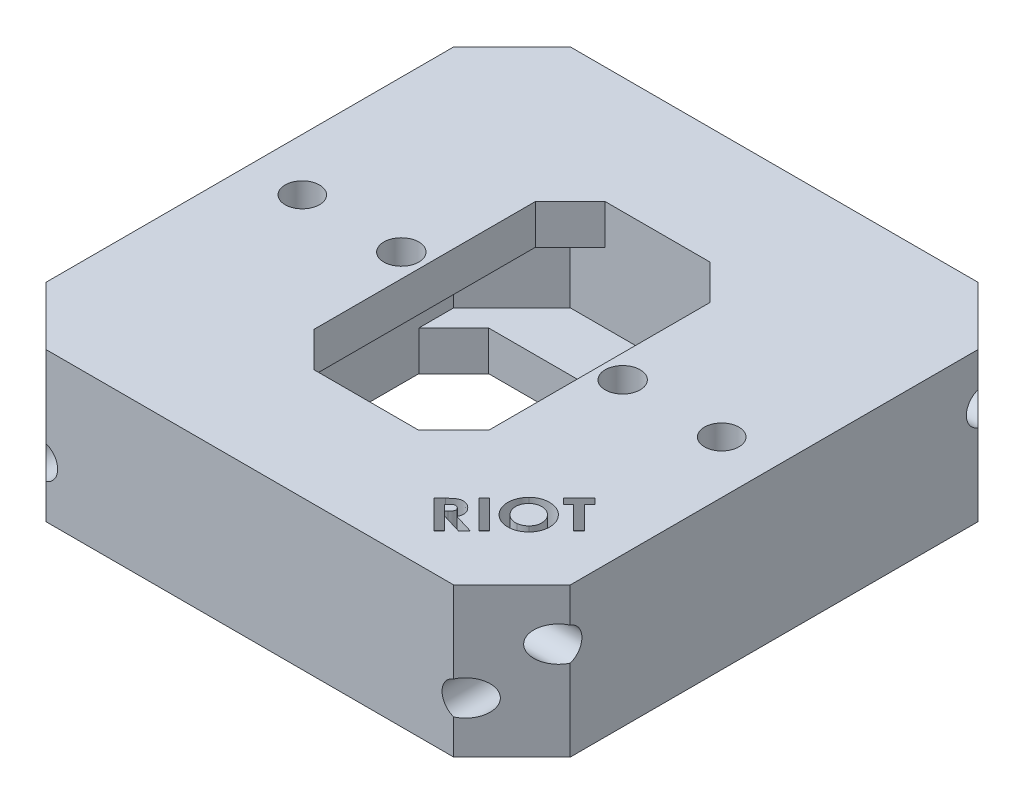
from build123d import *
from build123d.topology import SkipClean

# Parameters (mm, degrees)
SKETCH_1_W              = 45
SKETCH_1_H              = 10
SKETCH_1_R              = 1.5
EXTRUDE_1_DEPTH         = 45
SKETCH_2_R              = 1.5
CUT_EXTRUDE_1_DEPTH     = 45
CHAMFER_1_SIZE          = 5
SKETCH_4_W              = 25
SKETCH_4_H              = 25
CUT_EXTRUDE_3_DEPTH     = 52.295711322
CHAMFER_2_SIZE          = 5
SKETCH_5_R              = 1.5
EXTRUDE_2_DEPTH         = 2
EXTRUDE_3_DEPTH         = 2
CHAMFER_3_SIZE          = 3
CUT_EXTRUDE_4_DEPTH     = 1
CUT_EXTRUDE_START       = -10
CUT_EXTRUDE_5_OUTLINE_R = 1.5
CUT_EXTRUDE_5_DEPTH     = 7
SKETCH_16_R             = 1.475
CUT_EXTRUDE_6_DEPTH     = 7
EXTRUDE_START           = 1.4
SKETCH_16_3_R           = 1.5
SKETCH_16_3_R_2         = 1.475
EXTRUDE_4_DEPTH         = 1.4
SKETCH_17_R             = 2.75
SKETCH_17_R_2           = 1.5
EXTRUDE_5_DEPTH         = 1.4
EXTRUDE_6_DEPTH         = 1.4


# Read off the part's stored shape, not the designer's step: 컷-돌출5
with BuildPart() as part:
    # 스케치1 → 보스-돌출1 (new body)
    with BuildSketch(Plane(origin=(0, 0, 0), x_dir=(0, 0, -1), z_dir=(1, 0, 0))):
        Rectangle(SKETCH_1_W, SKETCH_1_H)
        with Locations(Location((-18, 2, 0), (0, 0, 180))):
            Circle(SKETCH_1_R, mode=Mode.SUBTRACT)
        with Locations(Location((18, 2, 0), (0, 0, 180))):
            Circle(SKETCH_1_R, mode=Mode.SUBTRACT)
    extrude(amount=EXTRUDE_1_DEPTH)

    # 스케치2 → 컷-돌출1 (cut)
    with BuildSketch(Plane.XY.offset(22.5)):
        with Locations((4.5, -2)):
            Circle(SKETCH_2_R)
        with Locations((40.5, -2)):
            Circle(SKETCH_2_R)
    extrude(amount=-CUT_EXTRUDE_1_DEPTH, mode=Mode.SUBTRACT)

    # 모따기1
    # the kernel refuses this chamfer: 5 mm, written as the material it takes off along each edge
    with BuildSketch(Plane(origin=(45, 17.85841494, 22.5), x_dir=(-0.9996219169112968, 0, 0.027495876610586317), z_dir=(0, -1, 0)), Plane(origin=(45, -17.85841494, -22.5), x_dir=(-0.9996219169112968, 0, -0.027495876610586317), z_dir=(0, 1, 0))) as chamfer_1_piece_1:
        Polygon((CHAMFER_1_SIZE * 0.999621916911, CHAMFER_1_SIZE * 0.0274958766106), (-CHAMFER_1_SIZE * 0.0274958766106, CHAMFER_1_SIZE * 0.999621916911), (0, 0), align=None)
    extrude(amount=35.71682988, mode=Mode.SUBTRACT)
    with BuildSketch(Plane(origin=(0, 17.85841494, 22.5), x_dir=(0.9996219169112968, 0, 0.027495876610586317), z_dir=(0, -1, 0)), Plane(origin=(0, -17.85841494, -22.5), x_dir=(0.9996219169112968, 0, -0.027495876610586317), z_dir=(0, 1, 0))) as chamfer_1_piece_2:
        Polygon((CHAMFER_1_SIZE * 0.999621916911, -CHAMFER_1_SIZE * 0.0274958766106), (-CHAMFER_1_SIZE * 0.0274958766106, -CHAMFER_1_SIZE * 0.999621916911), (0, 0), align=None)
    extrude(amount=35.71682988, mode=Mode.SUBTRACT)

    # 스케치4 → 컷-돌출3 (cut, through all)
    with BuildSketch(Plane.XZ.offset(5)):
        with Locations((22.5, 0)):
            Rectangle(SKETCH_4_W, SKETCH_4_H)
    extrude(amount=-CUT_EXTRUDE_3_DEPTH, mode=Mode.SUBTRACT)

    # 모따기2
    chamfer_2_edges = [part.edges().sort_by_distance(p)[0] for p in [
        (35, 0, 12.5),
        (35, 0, -12.5),
        (10, 0, -12.5),
        (10, 0, 12.5),
    ]]
    chamfer(chamfer_2_edges, length=CHAMFER_2_SIZE)

    # 스케치5 → 보스-돌출2 (add)
    # profile 1 of 2: a face of its own
    with BuildSketch(Plane(origin=(0, 5, 0), x_dir=(1, 0, 0), z_dir=(0, 1, 0))):
        Polygon((15, 12.5), (10, 7.5), (10, -7.5), (15, -12.5), align=None)
        with Locations(Location((13, 0, 0), (0, 0, 270))):
            Circle(SKETCH_5_R, mode=Mode.SUBTRACT)
    # profile 2 of 2: a face of its own
    with BuildSketch(Plane(origin=(0, 5, 0), x_dir=(1, 0, 0), z_dir=(0, 1, 0))):
        Polygon((35, 7.5), (30, 12.5), (30, -12.5), (35, -7.5), align=None)
        with Locations(Location((32, 0, 0), (0, 0, 270))):
            Circle(SKETCH_5_R, mode=Mode.SUBTRACT)
    extrude(amount=-EXTRUDE_2_DEPTH)

    # 스케치14 → 보스-돌출3 (add)
    with BuildSketch(Plane.XZ.offset(5)):
        with BuildLine():
            Line((22.5, 12.5), (15, 12.5))
            Line((15, 12.5), (10, 7.5))
            Line((10, 7.5), (22.5, 7.5))
            Line((22.5, 7.5), (22.5, 8))
            ThreePointArc((22.5, 8), (21, 9.5), (22.5, 11))
            Line((22.5, 11), (22.5, 12.5))
        make_face()
        with BuildLine():
            Line((30, 12.5), (22.5, 12.5))
            Line((22.5, 12.5), (22.5, 11))
            ThreePointArc((22.5, 11), (23.560660172, 10.560660172), (24, 9.5))
            ThreePointArc((24, 9.5), (23.560660172, 8.439339828), (22.5, 8))
            Line((22.5, 8), (22.5, 7.5))
            Line((22.5, 7.5), (35, 7.5))
            Line((35, 7.5), (30, 12.5))
        make_face()
        with BuildLine():
            Line((22.5, -7.5), (10, -7.5))
            Line((10, -7.5), (15, -12.5))
            Line((15, -12.5), (22.5, -12.5))
            Line((22.5, -12.5), (22.5, -11))
            ThreePointArc((22.5, -11), (21, -9.5), (22.5, -8))
            Line((22.5, -8), (22.5, -7.5))
        make_face()
        with BuildLine():
            Line((35, -7.5), (22.5, -7.5))
            Line((22.5, -7.5), (22.5, -8))
            ThreePointArc((22.5, -8), (23.560660172, -8.439339828), (24, -9.5))
            ThreePointArc((24, -9.5), (23.560660172, -10.560660172), (22.5, -11))
            Line((22.5, -11), (22.5, -12.5))
            Line((22.5, -12.5), (30, -12.5))
            Line((30, -12.5), (35, -7.5))
        make_face()
    extrude(amount=-EXTRUDE_3_DEPTH)

    # 모따기3
    chamfer_3_edges = [part.edges().sort_by_distance(p)[0] for p in [
        (10, -4, -7.5),
        (30, 4, 12.5),
        (15, 4, 12.5),
        (30, 4, -12.5),
        (10, -4, 7.5),
        (35, -4, -7.5),
        (35, -4, 7.5),
        (15, 4, -12.5),
    ]]
    chamfer(chamfer_3_edges, length=CHAMFER_3_SIZE)

    # 스케치7 → 컷-돌출4 (cut)
    # profile 1 of 4: a face of its own
    with BuildSketch(Plane(origin=(0, 5, 0), x_dir=(1, 0, 0), z_dir=(0, 1, 0))):
        with BuildLine():
            Line((32.69686165, -16.903699247), (33.191853637, -16.40870726))
            add(Edge.make_bspline(
                [(33.191853637, -16.40870726), (33.224607432, -16.376248536), (33.287670671, -16.313753417), (33.381930551, -16.226834822), (33.470630659, -16.148758016), (33.554657915, -16.080760449), (33.633419233, -16.02217285), (33.706831072, -15.972764042), (33.775533398, -15.93297044), (33.860329626, -15.893900224), (33.965605336, -15.859904661), (34.09508357, -15.839947634), (34.228088263, -15.84176179), (34.339500518, -15.860481767), (34.428871525, -15.883838888), (34.495162982, -15.908322558), (34.560225862, -15.936736442), (34.623931754, -15.970816372), (34.686085271, -16.010161334), (34.747366662, -16.05417477), (34.806330336, -16.104480821), (34.844108699, -16.140687951), (34.863327996, -16.159107901)],
                knots=[0, 0, 0, 0, 1.422154072, 2.738175696, 3.954007428, 5.066258713, 6.07111109, 6.980756347, 7.794367798, 8.516816989, 9.857210367, 11.19167909, 12.539706685, 13.941622086, 14.665508274, 15.386049031, 16.118675321, 16.85392105, 17.611889264, 18.386168488, 19.178982248, 20, 20, 20, 20], degree=3))
            add(Edge.make_bspline(
                [(34.863327996, -16.159107901), (34.882817903, -16.179149167), (34.921073132, -16.218486614), (34.971877821, -16.281393644), (35.018150795, -16.344139417), (35.056692325, -16.409268121), (35.089555533, -16.47516444), (35.117630745, -16.541840879), (35.137442806, -16.610216106), (35.152709568, -16.679248782), (35.1607445, -16.749476952), (35.163817599, -16.820973714), (35.160194113, -16.893705718), (35.150197519, -16.967771734), (35.134130783, -17.042826498), (35.110994783, -17.118908015), (35.083559092, -17.196760523), (35.060273514, -17.247878885), (35.04842415, -17.273891555)],
                knots=[0, 0, 0, 0, 1.101689547, 2.162421059, 3.185457246, 4.17318816, 5.14164527, 6.087972672, 7.020925025, 7.944500735, 8.872616505, 9.804065822, 10.763537599, 11.739680304, 12.748212312, 13.786204576, 14.873462919, 16, 16, 16, 16], degree=3))
            Line((35.04842415, -17.273891555), (36.717094022, -17.782905978))
            Line((36.717094022, -17.782905978), (36.207378477, -18.292621523))
            Line((36.207378477, -18.292621523), (34.61863649, -17.806042997))
            Line((34.61863649, -17.806042997), (34.575166939, -17.849512549))
            Line((34.575166939, -17.849512549), (35.612827195, -18.887172805))
            Line((35.612827195, -18.887172805), (35.146581201, -19.353418799))
            Line((35.146581201, -19.353418799), (32.69686165, -16.903699247))
        make_face()
        with BuildLine():
            Line((34.120840015, -17.395185626), (34.267374471, -17.24865117))
            add(Edge.make_bspline(
                [(34.267374471, -17.24865117), (34.285061302, -17.230570544), (34.318955448, -17.19592175), (34.365192156, -17.143729348), (34.406263823, -17.094864234), (34.440863472, -17.047884552), (34.468700195, -17.003205247), (34.49122115, -16.961550022), (34.506721484, -16.921937517), (34.520212458, -16.87313539), (34.522257608, -16.811772684), (34.504794782, -16.739163289), (34.464768514, -16.668893029), (34.426985206, -16.627649571), (34.406897708, -16.605722485)],
                knots=[0, 0, 0, 0, 1.200968113, 2.30147435, 3.310417574, 4.231675387, 5.069313759, 5.80902267, 6.476791062, 7.085197515, 8.207043583, 9.348428935, 10.590292078, 12, 12, 12, 12], degree=3))
            add(Edge.make_bspline(
                [(34.406897708, -16.605722485), (34.393402946, -16.593450494), (34.367046194, -16.56948195), (34.323258746, -16.540119649), (34.276182529, -16.51957649), (34.227143333, -16.507059955), (34.177249915, -16.502066364), (34.12732162, -16.504910809), (34.077975223, -16.515686783), (34.036977506, -16.530797721), (34.003556989, -16.548879317), (33.974827526, -16.56607619), (33.94415958, -16.589005092), (33.910467171, -16.615896569), (33.873158956, -16.646307605), (33.834208239, -16.682734586), (33.791360202, -16.722126471), (33.762697264, -16.750746465), (33.747843221, -16.765578254)],
                knots=[0, 0, 0, 0, 1.128469128, 2.204024108, 3.24716467, 4.293011438, 5.325357643, 6.339905205, 7.375794654, 8.442749747, 9.03176661, 9.726624713, 10.513874098, 11.399736492, 12.396482678, 13.492478502, 14.700522811, 16, 16, 16, 16], degree=3))
            Line((33.747843221, -16.765578254), (33.619537932, -16.893883542))
            Line((33.619537932, -16.893883542), (34.120840015, -17.395185626))
        make_face(mode=Mode.SUBTRACT)
    # profile 2 of 4: a face of its own
    with BuildSketch(Plane(origin=(0, 5, 0), x_dir=(1, 0, 0), z_dir=(0, 1, 0))):
        Polygon((34.631294923, -14.969265975), (35.094035307, -14.50652559), (37.543754858, -16.956245142), (37.081014474, -17.418985526), align=None)
    # profile 3 of 4: a face of its own
    with BuildSketch(Plane(origin=(0, 5, 0), x_dir=(1, 0, 0), z_dir=(0, 1, 0))):
        with BuildLine():
            add(Edge.make_bspline(
                [(36.711975525, -12.765187936), (36.755532817, -12.723542034), (36.841491891, -12.641355033), (36.983778236, -12.536369686), (37.132223388, -12.446631233), (37.288052443, -12.372996122), (37.451599228, -12.317022117), (37.622109966, -12.276920325), (37.79963219, -12.253272127), (37.981965934, -12.245713484), (38.164605465, -12.25448407), (38.343307689, -12.280504441), (38.515568224, -12.323186499), (38.681239301, -12.383064424), (38.839991055, -12.460081199), (38.991938886, -12.554076656), (39.138176398, -12.664241719), (39.227696417, -12.749314103), (39.273173442, -12.792531686)],
                knots=[0, 0, 0, 0, 1.014654119, 2.002390975, 2.972293047, 3.934222426, 4.900712244, 5.879869384, 6.881321836, 7.914074224, 8.951120508, 9.958117793, 10.95246705, 11.9366565, 12.921287122, 13.92029724, 14.943491126, 16, 16, 16, 16], degree=3))
            add(Edge.make_bspline(
                [(39.273173442, -12.792531686), (39.315883883, -12.837574141), (39.400044698, -12.926330183), (39.509539062, -13.07093332), (39.602823109, -13.221505088), (39.678999866, -13.37868177), (39.738183457, -13.542218987), (39.780526235, -13.712323254), (39.805297794, -13.888776996), (39.814470606, -14.069239359), (39.806776634, -14.24925402), (39.783239133, -14.424975102), (39.742443688, -14.594186284), (39.684613599, -14.756658429), (39.610822654, -14.91270353), (39.519267663, -15.061038485), (39.412747664, -15.204026587), (39.329964783, -15.291201005), (39.287897, -15.335500436)],
                knots=[0, 0, 0, 0, 1.051548114, 2.072072851, 3.068153082, 4.049734895, 5.027207055, 6.011088518, 7.015617405, 8.042955091, 9.069926077, 10.065509878, 11.043656146, 12.014725186, 12.984022916, 13.963756318, 14.96524187, 16, 16, 16, 16], degree=3))
            add(Edge.make_bspline(
                [(39.287897, -15.335500436), (39.241760237, -15.379470424), (39.151264361, -15.465716237), (39.002974685, -15.576852413), (38.849875723, -15.6714323), (38.689521803, -15.746973256), (38.523812357, -15.805639308), (38.351399212, -15.84558232), (38.173087409, -15.868006687), (37.990888181, -15.872471118), (37.809242972, -15.860809153), (37.632200511, -15.832803767), (37.462205679, -15.788596597), (37.298928096, -15.728634248), (37.142937253, -15.652766266), (36.994095663, -15.560609182), (36.85142195, -15.453494759), (36.764464781, -15.370537557), (36.720388987, -15.328489218)],
                knots=[0, 0, 0, 0, 1.068725463, 2.096272975, 3.103195773, 4.083868974, 5.065012596, 6.047722666, 7.047870852, 8.075777557, 9.101564702, 10.09838547, 11.079121407, 12.044468732, 13.012695726, 13.984672525, 14.978495282, 16, 16, 16, 16], degree=3))
            add(Edge.make_bspline(
                [(36.720388987, -15.328489218), (36.691945083, -15.298935997), (36.635520731, -15.240311087), (36.558485324, -15.146626434), (36.488122967, -15.049766129), (36.424862209, -14.949289741), (36.368714667, -14.845274442), (36.319277996, -14.737945567), (36.278268103, -14.626587359), (36.242948721, -14.512757558), (36.215878773, -14.396730565), (36.196194186, -14.280127799), (36.183864724, -14.16327175), (36.180965357, -14.046373882), (36.183847734, -13.929227021), (36.196461634, -13.812237533), (36.21482678, -13.694734981), (36.242743545, -13.578106253), (36.276203817, -13.462741145), (36.319020083, -13.351537301), (36.36629191, -13.243273443), (36.422086116, -13.139886697), (36.483743453, -13.039450726), (36.553537938, -12.944126799), (36.628236671, -12.851065146), (36.683912745, -12.793967327), (36.711975525, -12.765187936)],
                knots=[0, 0, 0, 0, 1.035920658, 2.054962298, 3.061180531, 4.058787372, 5.052104391, 6.045509142, 7.041297254, 8.047948452, 9.054738158, 10.048686678, 11.03391657, 12.020366407, 13.000914665, 13.992018259, 14.990829929, 16.003368278, 17.019618089, 18.023008813, 19.011559078, 20.002082148, 20.988425963, 21.986399645, 22.9850717, 24, 24, 24, 24], degree=3))
        make_face()
        with BuildLine():
            add(Edge.make_bspline(
                [(37.163497961, -13.226526077), (37.136219872, -13.254957919), (37.08257697, -13.310869698), (37.014169414, -13.402928052), (36.954866624, -13.497880203), (36.908151077, -13.597935393), (36.871459032, -13.701465673), (36.84503826, -13.808981945), (36.830820246, -13.920674302), (36.826469993, -14.034978144), (36.833409424, -14.149605568), (36.85171309, -14.262352336), (36.881037304, -14.371937364), (36.922270332, -14.478008412), (36.97448449, -14.580826236), (37.037913559, -14.680538204), (37.112329539, -14.777242678), (37.169460514, -14.836814537), (37.198554051, -14.867151077)],
                knots=[0, 0, 0, 0, 1.029769062, 2.025061205, 2.993902875, 3.953811187, 4.907077266, 5.863474848, 6.84397402, 7.84727022, 8.851757806, 9.842759715, 10.830437119, 11.813639021, 12.814324118, 13.842131367, 14.90112093, 16, 16, 16, 16], degree=3))
            add(Edge.make_bspline(
                [(37.198554051, -14.867151077), (37.232273535, -14.899203514), (37.298337923, -14.962001763), (37.406500914, -15.04207695), (37.518123941, -15.108587768), (37.633867866, -15.16027969), (37.753303556, -15.196955094), (37.876328769, -15.219348672), (38.003447269, -15.228535924), (38.088995407, -15.222287838), (38.132448282, -15.219114218)],
                knots=[0, 0, 0, 0, 1.079353868, 2.114707675, 3.116998339, 4.091101001, 5.050584441, 6.010604784, 6.989516965, 8, 8, 8, 8], degree=3))
            add(Edge.make_bspline(
                [(38.132448282, -15.219114218), (38.166182752, -15.214706154), (38.23293114, -15.20598418), (38.330675649, -15.184308529), (38.424583065, -15.154038814), (38.514344389, -15.115056833), (38.601056208, -15.069457553), (38.68412883, -15.016089895), (38.763033166, -14.954097308), (38.811739404, -14.90753087), (38.836374564, -14.883978)],
                knots=[0, 0, 0, 0, 1.025969275, 2.030024327, 3.015491562, 3.997700127, 4.978516044, 5.968060363, 6.972263918, 8, 8, 8, 8], degree=3))
            add(Edge.make_bspline(
                [(38.836374564, -14.883978), (38.862987701, -14.8562727), (38.915436155, -14.80167184), (38.981650092, -14.710739899), (39.039290191, -14.61695475), (39.084829188, -14.517641448), (39.121059569, -14.414515743), (39.14537135, -14.306492007), (39.159391471, -14.19449279), (39.162703878, -14.079473128), (39.15580548, -13.964016826), (39.138624616, -13.850693036), (39.109425096, -13.741350166), (39.070156873, -13.635841894), (39.020000696, -13.534042919), (38.958600982, -13.436601971), (38.886875672, -13.342370429), (38.831589387, -13.284669728), (38.80342184, -13.255272071)],
                knots=[0, 0, 0, 0, 1.015027565, 2.000389023, 2.968300073, 3.922453554, 4.884285459, 5.854503292, 6.845124793, 7.865559069, 8.893567005, 9.900733638, 10.891837198, 11.881590401, 12.874061732, 13.887733113, 14.923831134, 16, 16, 16, 16], degree=3))
            add(Edge.make_bspline(
                [(38.80342184, -13.255272071), (38.773976402, -13.227398123), (38.716071372, -13.172583458), (38.622361792, -13.100595517), (38.524228606, -13.040376526), (38.4228899, -12.988943526), (38.316715544, -12.949770223), (38.206407624, -12.921917414), (38.092662432, -12.903278291), (37.976161732, -12.896755251), (37.860255784, -12.900031495), (37.746939702, -12.913783726), (37.638404303, -12.939477352), (37.533477278, -12.97390891), (37.434387068, -13.022185447), (37.338417133, -13.078601933), (37.247432155, -13.147134737), (37.191756422, -13.199797077), (37.163497961, -13.226526077)],
                knots=[0, 0, 0, 0, 1.065222127, 2.094780232, 3.098807823, 4.08774636, 5.077009148, 6.066252866, 7.074087619, 8.10173825, 9.128011098, 10.118474599, 11.095919373, 12.055501853, 13.014415649, 13.986751589, 14.978167001, 16, 16, 16, 16], degree=3))
        make_face(mode=Mode.SUBTRACT)
    # profile 4 of 4: a face of its own
    with BuildSketch(Plane(origin=(0, 5, 0), x_dir=(1, 0, 0), z_dir=(0, 1, 0))):
        Polygon((38.262288952, -11.338271945), (39.616155138, -9.984405759), (40.076091036, -10.444341657), (39.629476452, -10.89095624), (41.619260106, -12.880739894), (41.146704017, -13.353295983), (39.156920363, -11.36351233), (38.72222485, -11.798207842), align=None)
    extrude(amount=-CUT_EXTRUDE_4_DEPTH, mode=Mode.SUBTRACT)

    # 컷-돌출5 outline → 컷-돌출5 (cut)
    with BuildSketch(Plane(origin=(0, 5, 0), x_dir=(1, 0, 0), z_dir=(0, 1, 0)).offset(CUT_EXTRUDE_START)):
        with Locations((22.5, -17.5)):
            Circle(CUT_EXTRUDE_5_OUTLINE_R)
        with Locations((22.5, 17.5)):
            Circle(CUT_EXTRUDE_5_OUTLINE_R)
    extrude(amount=CUT_EXTRUDE_5_DEPTH, mode=Mode.SUBTRACT)

    # 스케치16 → 컷-돌출6 (cut)
    with BuildSketch(Plane(origin=(0, 5, 0), x_dir=(1, 0, 0), z_dir=(0, 1, 0))):
        with Locations(Location((4.5, 0, 0), (0, 0, 270))):
            Circle(SKETCH_16_R)
        with Locations(Location((40.5, 0, 0), (0, 0, 270))):
            Circle(SKETCH_16_R)
    extrude(amount=-CUT_EXTRUDE_6_DEPTH, mode=Mode.SUBTRACT)

    # 스케치16<3> → 보스-돌출4 (add)
    with BuildSketch(Plane(origin=(0, 5, 0), x_dir=(1, 0, 0), z_dir=(0, 1, 0)).offset(EXTRUDE_START)):
        Polygon((5, 22.5), (0, 17.5), (0, -17.5), (5, -22.5), (40, -22.5), (45, -17.5), (45, 17.5), (40, 22.5), align=None)
        with BuildLine():
            Line((35.146581201, -19.353418799), (32.69686165, -16.903699247))
            Line((32.69686165, -16.903699247), (33.191853637, -16.40870726))
            add(Edge.make_bspline(
                [(33.191853637, -16.40870726), (33.224607432, -16.376248536), (33.287670671, -16.313753417), (33.381930551, -16.226834822), (33.470630659, -16.148758016), (33.554657915, -16.080760449), (33.633419233, -16.02217285), (33.706831072, -15.972764042), (33.775533398, -15.93297044), (33.860329626, -15.893900224), (33.965605336, -15.859904661), (34.09508357, -15.839947634), (34.228088263, -15.84176179), (34.339500518, -15.860481767), (34.428871525, -15.883838888), (34.495162982, -15.908322558), (34.560225862, -15.936736442), (34.623931754, -15.970816372), (34.686085271, -16.010161334), (34.747366662, -16.05417477), (34.806330336, -16.104480821), (34.844108699, -16.140687951), (34.863327996, -16.159107901)],
                knots=[0, 0, 0, 0, 1.422154072, 2.738175696, 3.954007428, 5.066258713, 6.07111109, 6.980756347, 7.794367798, 8.516816989, 9.857210367, 11.19167909, 12.539706685, 13.941622086, 14.665508274, 15.386049031, 16.118675321, 16.85392105, 17.611889264, 18.386168488, 19.178982248, 20, 20, 20, 20], degree=3))
            add(Edge.make_bspline(
                [(34.863327996, -16.159107901), (34.882817903, -16.179149167), (34.921073132, -16.218486614), (34.971877821, -16.281393644), (35.018150795, -16.344139417), (35.056692325, -16.409268121), (35.089555533, -16.47516444), (35.117630745, -16.541840879), (35.137442806, -16.610216106), (35.152709568, -16.679248782), (35.1607445, -16.749476952), (35.163817599, -16.820973714), (35.160194113, -16.893705718), (35.150197519, -16.967771734), (35.134130783, -17.042826498), (35.110994783, -17.118908015), (35.083559092, -17.196760523), (35.060273514, -17.247878885), (35.04842415, -17.273891555)],
                knots=[0, 0, 0, 0, 1.101689547, 2.162421059, 3.185457246, 4.17318816, 5.14164527, 6.087972672, 7.020925025, 7.944500735, 8.872616505, 9.804065822, 10.763537599, 11.739680304, 12.748212312, 13.786204576, 14.873462919, 16, 16, 16, 16], degree=3))
            Line((35.04842415, -17.273891555), (36.717094022, -17.782905978))
            Line((36.717094022, -17.782905978), (36.207378477, -18.292621523))
            Line((36.207378477, -18.292621523), (34.61863649, -17.806042997))
            Line((34.61863649, -17.806042997), (34.575166939, -17.849512549))
            Line((34.575166939, -17.849512549), (35.612827195, -18.887172805))
            Line((35.612827195, -18.887172805), (35.146581201, -19.353418799))
        make_face(mode=Mode.SUBTRACT)
        Polygon((37.081014474, -17.418985526), (34.631294923, -14.969265975), (35.094035307, -14.50652559), (37.543754858, -16.956245142), align=None, mode=Mode.SUBTRACT)
        with BuildLine():
            add(Edge.make_bspline(
                [(36.720388987, -15.328489218), (36.691945083, -15.298935997), (36.635520731, -15.240311087), (36.558485324, -15.146626434), (36.488122967, -15.049766129), (36.424862209, -14.949289741), (36.368714667, -14.845274442), (36.319277996, -14.737945567), (36.278268103, -14.626587359), (36.242948721, -14.512757558), (36.215878773, -14.396730565), (36.196194186, -14.280127799), (36.183864724, -14.16327175), (36.180965357, -14.046373882), (36.183847734, -13.929227021), (36.196461634, -13.812237533), (36.21482678, -13.694734981), (36.242743545, -13.578106253), (36.276203817, -13.462741145), (36.319020083, -13.351537301), (36.36629191, -13.243273443), (36.422086116, -13.139886697), (36.483743453, -13.039450726), (36.553537938, -12.944126799), (36.628236671, -12.851065146), (36.683912745, -12.793967327), (36.711975525, -12.765187936)],
                knots=[0, 0, 0, 0, 1.035920658, 2.054962298, 3.061180531, 4.058787372, 5.052104391, 6.045509142, 7.041297254, 8.047948452, 9.054738158, 10.048686678, 11.03391657, 12.020366407, 13.000914665, 13.992018259, 14.990829929, 16.003368278, 17.019618089, 18.023008813, 19.011559078, 20.002082148, 20.988425963, 21.986399645, 22.9850717, 24, 24, 24, 24], degree=3))
            add(Edge.make_bspline(
                [(36.711975525, -12.765187936), (36.755532817, -12.723542034), (36.841491891, -12.641355033), (36.983778236, -12.536369686), (37.132223388, -12.446631233), (37.288052443, -12.372996122), (37.451599228, -12.317022117), (37.622109966, -12.276920325), (37.79963219, -12.253272127), (37.981965934, -12.245713484), (38.164605465, -12.25448407), (38.343307689, -12.280504441), (38.515568224, -12.323186499), (38.681239301, -12.383064424), (38.839991055, -12.460081199), (38.991938886, -12.554076656), (39.138176398, -12.664241719), (39.227696417, -12.749314103), (39.273173442, -12.792531686)],
                knots=[0, 0, 0, 0, 1.014654119, 2.002390975, 2.972293047, 3.934222426, 4.900712244, 5.879869384, 6.881321836, 7.914074224, 8.951120508, 9.958117793, 10.95246705, 11.9366565, 12.921287122, 13.92029724, 14.943491126, 16, 16, 16, 16], degree=3))
            add(Edge.make_bspline(
                [(39.273173442, -12.792531686), (39.315883883, -12.837574141), (39.400044698, -12.926330183), (39.509539062, -13.07093332), (39.602823109, -13.221505088), (39.678999866, -13.37868177), (39.738183457, -13.542218987), (39.780526235, -13.712323254), (39.805297794, -13.888776996), (39.814470606, -14.069239359), (39.806776634, -14.24925402), (39.783239133, -14.424975102), (39.742443688, -14.594186284), (39.684613599, -14.756658429), (39.610822654, -14.91270353), (39.519267663, -15.061038485), (39.412747664, -15.204026587), (39.329964783, -15.291201005), (39.287897, -15.335500436)],
                knots=[0, 0, 0, 0, 1.051548114, 2.072072851, 3.068153082, 4.049734895, 5.027207055, 6.011088518, 7.015617405, 8.042955091, 9.069926077, 10.065509878, 11.043656146, 12.014725186, 12.984022916, 13.963756318, 14.96524187, 16, 16, 16, 16], degree=3))
            add(Edge.make_bspline(
                [(39.287897, -15.335500436), (39.241760237, -15.379470424), (39.151264361, -15.465716237), (39.002974685, -15.576852413), (38.849875723, -15.6714323), (38.689521803, -15.746973256), (38.523812357, -15.805639308), (38.351399212, -15.84558232), (38.173087409, -15.868006687), (37.990888181, -15.872471118), (37.809242972, -15.860809153), (37.632200511, -15.832803767), (37.462205679, -15.788596597), (37.298928096, -15.728634248), (37.142937253, -15.652766266), (36.994095663, -15.560609182), (36.85142195, -15.453494759), (36.764464781, -15.370537557), (36.720388987, -15.328489218)],
                knots=[0, 0, 0, 0, 1.068725463, 2.096272975, 3.103195773, 4.083868974, 5.065012596, 6.047722666, 7.047870852, 8.075777557, 9.101564702, 10.09838547, 11.079121407, 12.044468732, 13.012695726, 13.984672525, 14.978495282, 16, 16, 16, 16], degree=3))
        make_face(mode=Mode.SUBTRACT)
        Polygon((38.72222485, -11.798207842), (38.262288952, -11.338271945), (39.616155138, -9.984405759), (40.076091036, -10.444341657), (39.629476452, -10.89095624), (41.619260106, -12.880739894), (41.146704017, -13.353295983), (39.156920363, -11.36351233), align=None, mode=Mode.SUBTRACT)
        Polygon((15, -9.5), (15, 9.5), (18, 12.5), (27, 12.5), (30, 9.5), (30, -9.5), (27, -12.5), (18, -12.5), align=None, mode=Mode.SUBTRACT)
        with Locations(Location((13, 0, 0), (0, 0, 270))):
            Circle(SKETCH_16_3_R, mode=Mode.SUBTRACT)
        with Locations(Location((32, 0, 0), (0, 0, 270))):
            Circle(SKETCH_16_3_R, mode=Mode.SUBTRACT)
        with Locations(Location((4.5, 0, 0), (0, 0, 270))):
            Circle(SKETCH_16_3_R_2, mode=Mode.SUBTRACT)
        with Locations(Location((40.5, 0, 0), (0, 0, 270))):
            Circle(SKETCH_16_3_R_2, mode=Mode.SUBTRACT)
    extrude(amount=-EXTRUDE_4_DEPTH)

    # 스케치17 → 보스-돌출5 (add)
    # profile 1 of 3: a face of its own
    with SkipClean():  # the faces are left unmerged after this step: merging them gives an invalid solid
        with BuildSketch(Plane.XZ.offset(5).offset(EXTRUDE_START)):
            Polygon((45, 17.5), (40, 22.5), (5, 22.5), (0, 17.5), (0, -17.5), (5, -22.5), (40, -22.5), (45, -17.5), align=None)
            with Locations((22.5, 17.5)):
                Circle(SKETCH_17_R, mode=Mode.SUBTRACT)
            with Locations((22.5, -17.5)):
                Circle(SKETCH_17_R, mode=Mode.SUBTRACT)
            with Locations(Location((22.5, -9.5, 0), (0, 0, 270))):
                Circle(SKETCH_17_R_2, mode=Mode.SUBTRACT)
            with Locations(Location((22.5, 9.5, 0), (0, 0, 270))):
                Circle(SKETCH_17_R_2, mode=Mode.SUBTRACT)
            Polygon((35, -4.5), (32, -7.5), (13, -7.5), (10, -4.5), (10, 4.5), (13, 7.5), (32, 7.5), (35, 4.5), align=None, mode=Mode.SUBTRACT)
        # profile 2 of 3: a face of its own
        with BuildSketch(Plane.XZ.offset(5).offset(EXTRUDE_START)):
            with Locations((22.5, 17.5)):
                Circle(SKETCH_17_R)
            with Locations(Location((22.5, 17.5, 0), (0, 0, 270))):
                Circle(SKETCH_17_R_2, mode=Mode.SUBTRACT)
        # profile 3 of 3: a face of its own
        with BuildSketch(Plane.XZ.offset(5).offset(EXTRUDE_START)):
            with Locations((22.5, -17.5)):
                Circle(SKETCH_17_R)
            with Locations(Location((22.5, -17.5, 0), (0, 0, 270))):
                Circle(SKETCH_17_R_2, mode=Mode.SUBTRACT)
        extrude(amount=-EXTRUDE_5_DEPTH)

    # 스케치18 → 보스-돌출6 (add)
    with SkipClean():  # the faces are left unmerged after this step: merging them gives an invalid solid
        with BuildSketch(Plane(origin=(0, 5, 0), x_dir=(1, 0, 0), z_dir=(0, 1, 0))):
            with BuildLine():
                Line((33.619537932, -16.893883542), (34.120840015, -17.395185626))
                Line((34.120840015, -17.395185626), (34.267374471, -17.24865117))
                add(Edge.make_bspline(
                    [(34.267374471, -17.24865117), (34.285061302, -17.230570544), (34.318955448, -17.19592175), (34.365192156, -17.143729348), (34.406263823, -17.094864234), (34.440863472, -17.047884552), (34.468700195, -17.003205247), (34.49122115, -16.961550022), (34.506721484, -16.921937517), (34.520212458, -16.87313539), (34.522257608, -16.811772684), (34.504794782, -16.739163289), (34.464768514, -16.668893029), (34.426985206, -16.627649571), (34.406897708, -16.605722485)],
                    knots=[0, 0, 0, 0, 0.100080676, 0.191789529, 0.275868131, 0.352639616, 0.422442813, 0.484085222, 0.539732589, 0.590433126, 0.683920299, 0.779035745, 0.88252434, 1, 1, 1, 1], degree=3))
                add(Edge.make_bspline(
                    [(34.406897708, -16.605722485), (34.393402946, -16.593450494), (34.367046194, -16.56948195), (34.323258746, -16.540119649), (34.276182529, -16.51957649), (34.227143333, -16.507059955), (34.177249915, -16.502066364), (34.12732162, -16.504910809), (34.077975223, -16.515686783), (34.036977506, -16.530797721), (34.003556989, -16.548879317), (33.974827526, -16.56607619), (33.94415958, -16.589005092), (33.910467171, -16.615896569), (33.873158956, -16.646307605), (33.834208239, -16.682734586), (33.791360202, -16.722126471), (33.762697264, -16.750746465), (33.747843221, -16.765578254)],
                    knots=[0, 0, 0, 0, 0.07052932, 0.137751507, 0.202947792, 0.268313215, 0.332834853, 0.396244075, 0.460987166, 0.527671859, 0.564485413, 0.607914045, 0.657117131, 0.712483531, 0.774780167, 0.843279906, 0.918782676, 1, 1, 1, 1], degree=3))
                Line((33.747843221, -16.765578254), (33.619537932, -16.893883542))
            make_face()
            with BuildLine():
                add(Edge.make_bspline(
                    [(38.80342184, -13.255272071), (38.773976402, -13.227398123), (38.716071372, -13.172583458), (38.622361792, -13.100595517), (38.524228606, -13.040376526), (38.4228899, -12.988943526), (38.316715544, -12.949770223), (38.206407624, -12.921917414), (38.092662432, -12.903278291), (37.976161732, -12.896755251), (37.860255784, -12.900031495), (37.746939702, -12.913783726), (37.638404303, -12.939477352), (37.533477278, -12.97390891), (37.434387068, -13.022185447), (37.338417133, -13.078601933), (37.247432155, -13.147134737), (37.191756422, -13.199797077), (37.163497961, -13.226526077)],
                    knots=[0, 0, 0, 0, 0.066576383, 0.130923765, 0.193675489, 0.255484147, 0.317313072, 0.379140804, 0.442130476, 0.506358641, 0.570500694, 0.632404662, 0.693494961, 0.753468866, 0.813400978, 0.874171974, 0.936135438, 1, 1, 1, 1], degree=3))
                add(Edge.make_bspline(
                    [(37.163497961, -13.226526077), (37.136219872, -13.254957919), (37.08257697, -13.310869698), (37.014169414, -13.402928052), (36.954866624, -13.497880203), (36.908151077, -13.597935393), (36.871459032, -13.701465673), (36.84503826, -13.808981945), (36.830820246, -13.920674302), (36.826469993, -14.034978144), (36.833409424, -14.149605568), (36.85171309, -14.262352336), (36.881037304, -14.371937364), (36.922270332, -14.478008412), (36.97448449, -14.580826236), (37.037913559, -14.680538204), (37.112329539, -14.777242678), (37.169460514, -14.836814537), (37.198554051, -14.867151077)],
                    knots=[0, 0, 0, 0, 0.064360566, 0.126566325, 0.18711893, 0.247113199, 0.306692329, 0.366467178, 0.427748376, 0.490454389, 0.553234863, 0.615172482, 0.67690232, 0.738352439, 0.800895257, 0.86513321, 0.931320058, 1, 1, 1, 1], degree=3))
                add(Edge.make_bspline(
                    [(37.198554051, -14.867151077), (37.232273535, -14.899203514), (37.298337923, -14.962001763), (37.406500914, -15.04207695), (37.518123941, -15.108587768), (37.633867866, -15.16027969), (37.753303556, -15.196955094), (37.876328769, -15.219348672), (38.003447269, -15.228535924), (38.088995407, -15.222287838), (38.132448282, -15.219114218)],
                    knots=[0, 0, 0, 0, 0.134919233, 0.264338459, 0.389624792, 0.511387625, 0.631323055, 0.751325598, 0.873689621, 1, 1, 1, 1], degree=3))
                add(Edge.make_bspline(
                    [(38.132448282, -15.219114218), (38.166182752, -15.214706154), (38.23293114, -15.20598418), (38.330675649, -15.184308529), (38.424583065, -15.154038814), (38.514344389, -15.115056833), (38.601056208, -15.069457553), (38.68412883, -15.016089895), (38.763033166, -14.954097308), (38.811739404, -14.90753087), (38.836374564, -14.883978)],
                    knots=[0, 0, 0, 0, 0.128246159, 0.253753041, 0.376936445, 0.499712516, 0.622314505, 0.746007545, 0.87153299, 1, 1, 1, 1], degree=3))
                add(Edge.make_bspline(
                    [(38.836374564, -14.883978), (38.862987701, -14.8562727), (38.915436155, -14.80167184), (38.981650092, -14.710739899), (39.039290191, -14.61695475), (39.084829188, -14.517641448), (39.121059569, -14.414515743), (39.14537135, -14.306492007), (39.159391471, -14.19449279), (39.162703878, -14.079473128), (39.15580548, -13.964016826), (39.138624616, -13.850693036), (39.109425096, -13.741350166), (39.070156873, -13.635841894), (39.020000696, -13.534042919), (38.958600982, -13.436601971), (38.886875672, -13.342370429), (38.831589387, -13.284669728), (38.80342184, -13.255272071)],
                    knots=[0, 0, 0, 0, 0.063439223, 0.125024314, 0.185518755, 0.245153347, 0.305267841, 0.365906456, 0.4278203, 0.491597442, 0.555847938, 0.618795852, 0.680739825, 0.7425994, 0.804628858, 0.86798332, 0.932739446, 1, 1, 1, 1], degree=3))
            make_face()
        extrude(amount=EXTRUDE_6_DEPTH)


solid = part.part
